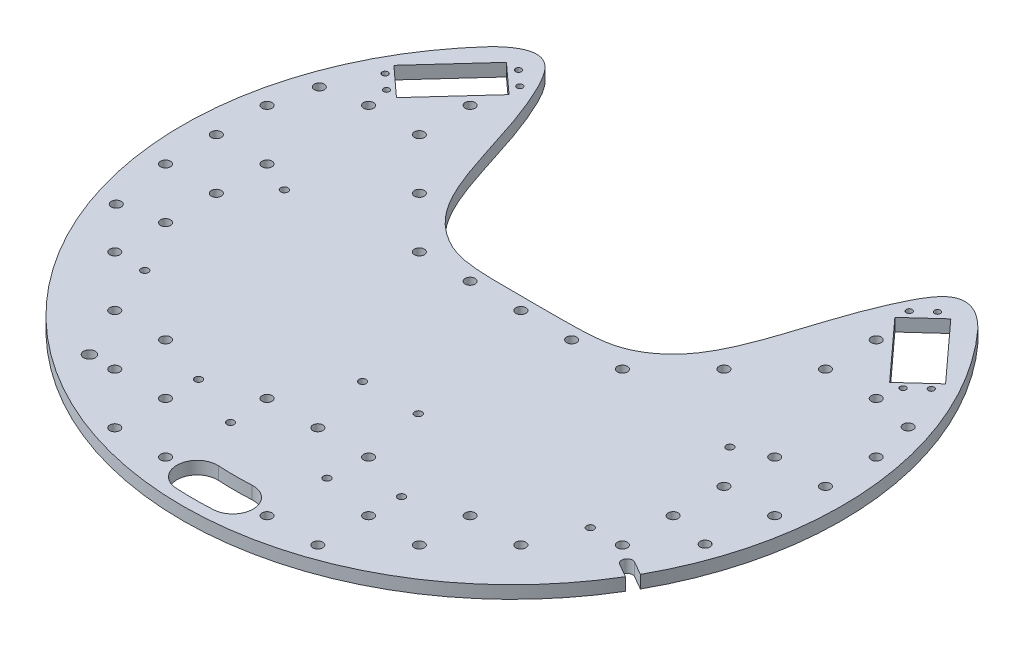
from build123d import *

# Parameters (mm, degrees)
SKETCH1_R                      = 164.975
BOSS_EXTRUDE1_DEPTH            = 6.35
F_6_CLEARANCE_HOLE1_D          = 3.6576
CUT_EXTRUDE1_START             = -6.35
CUT_EXTRUDE1_DEPTH             = 6.35
F_6_CLEARANCE_HOLE2_D          = 3.6576
F_6_CLEARANCE_HOLE2_DEPTH      = 25.4
F_6_CLEARANCE_HOLE2_TIP        = 1.0988539
F_10_CLEARANCE_HOLE3_D         = 4.9784
CUT_EXTRUDE2_DEPTH             = 234.396280641
F_4_CLEARANCE_HOLE1_AT_2_COUNT = 2
F_4_CLEARANCE_HOLE1_AT_2_PITCH = 10
F_4_CLEARANCE_HOLE1_AT_3_COUNT = 2
F_4_CLEARANCE_HOLE1_AT_3_PITCH = 48.306392952
F_4_CLEARANCE_HOLE1_AT_4_COUNT = 2
F_4_CLEARANCE_HOLE1_AT_4_PITCH = 47.26
F_6_CLEARANCE_HOLE5_D          = 3.6576
F_6_CLEARANCE_HOLE5_DEPTH      = 9.906
F_6_CLEARANCE_HOLE5_TIP        = 1.0988539
LPATTERN1_COUNT                = 7
LPATTERN1_PITCH                = 25.4
LPATTERN1_COUNT_DIR2           = 7
LPATTERN1_PITCH_DIR2           = 25.4
LPATTERN3_COUNT                = 4
LPATTERN3_PITCH                = 25.4
LPATTERN3_COUNT_DIR2           = 7
LPATTERN3_PITCH_DIR2           = 25.4
CUT_EXTRUDE3_DEPTH             = 234.396280641
SWITCH_HOLE_D                  = 5.8166
CUT_EXTRUDE4_DEPTH             = 234.396280641


# Read off the part's stored shape, not the designer's step: Cut-Extrude1
with BuildPart() as part:
    # Sketch1 → Boss-Extrude1 (new body)
    with BuildSketch(Plane(origin=(0, 0, 0), x_dir=(1, 0, 0), z_dir=(0, 1, 0))):
        with Locations(Location((0, 0, 0), (0, 0, 270))):
            Circle(SKETCH1_R)
    extrude(amount=BOSS_EXTRUDE1_DEPTH)

    # #6 Clearance Hole1 (through all)
    with Locations(Plane(origin=(111.465, 0, 2.54), x_dir=(0, 0, -1), z_dir=(0, -1, 0))):
        with Locations((0, 0), (-69.85, 0), (-69.85, -222.93), (0, -222.93)):
            Hole(F_6_CLEARANCE_HOLE1_D / 2)

    # Cut-Extrude1 outline → Cut-Extrude1 (cut)
    with BuildSketch(Plane(origin=(0, 6.35, 0), x_dir=(1, 0, 0), z_dir=(0, 1, 0)).offset(CUT_EXTRUDE1_START)):
        with BuildLine():
            add(Edge.make_bspline(
                [(-121.988554403, 111.065490679), (-113.823727633, 119.197396711), (-102.201622841, 123.81559601), (-77.6900656, 78.016737099), (-73.324622305, 34.879062258), (-40.365853898, 10.287477897), (-27.051658004, 10.681054333), (27.051658004, 10.681054333), (40.365853898, 10.287477897), (73.324622305, 34.879062258), (77.6900656, 78.016737099), (102.201622841, 123.81559601), (113.823727633, 119.197396711), (121.988554403, 111.065490679)],
                knots=[0, 0, 0, 0, 0.147126524, 0.222478827, 0.62365317, 0.69844766, 0.920276928, 0.920276928, 1.142106197, 1.216900687, 1.61807503, 1.693427333, 1.840553857, 1.840553857, 1.840553857, 1.840553857], degree=3))
            ThreePointArc((121.988554403, 111.065490679), (0, 164.975), (-121.988554403, 111.065490679))
        make_face()
    extrude(amount=CUT_EXTRUDE1_DEPTH, mode=Mode.SUBTRACT)

    # #6 Clearance Hole2
    with Locations(Plane(origin=(50.8, 6.35, 106.158945667), x_dir=(0, 0, 1), z_dir=(0, 1, 0))):
        with Locations((0, 0), (0, -101.6)):
            Hole(F_6_CLEARANCE_HOLE2_D / 2, depth=F_6_CLEARANCE_HOLE2_DEPTH)
            with Locations((0, 0, -(F_6_CLEARANCE_HOLE2_DEPTH + F_6_CLEARANCE_HOLE2_TIP / 2))):  # 118° drill point
                Cone(0, F_6_CLEARANCE_HOLE2_D / 2, F_6_CLEARANCE_HOLE2_TIP, mode=Mode.SUBTRACT)

    # #10 Clearance Hole3 (through all)
    with Locations(Plane(origin=(0, 6.35, 0), x_dir=(-1, 0, 0), z_dir=(0, 1, 0))):
        with Locations((147.32, -50.8), (147.32, 50.8), (-147.32, -50.8), (-147.32, 50.8)):
            Hole(F_10_CLEARANCE_HOLE3_D / 2)

    # Sketch20 → Cut-Extrude2 (cut, through all)
    with BuildSketch(Plane(origin=(0, 6.35, 0), x_dir=(1, 0, 0), z_dir=(0, 1, 0))):
        Polygon((-109.699539663, 80.469088467), (-96.519999999, 94.930350177), (-111.1630807, 108.275593959), (-124.593870916, 93.538647356), (-138.024661132, 78.801700753), (-130.703120781, 72.129078862), (-123.381580431, 65.456456971), align=None)
    cut_extrude2 = extrude(amount=-CUT_EXTRUDE2_DEPTH, mode=Mode.SUBTRACT)

    # Sketch21 → #4 Clearance Hole1 (revolve, cut)
    with BuildSketch(Plane(origin=(-104.804802432, 6.35, -107.979426396), x_dir=(0, 0, 1), z_dir=(1, 0, 0))):
        Polygon((0, 0), (0, 10.791187864), (1.4732, 9.906), (1.4732, 0), align=None)
    f_4_clearance_hole1 = revolve(axis=Axis((-104.804802432, 12.7, -107.979426396), (0, -1, 0)), mode=Mode.SUBTRACT)

    # #4 Clearance Hole1 at 2: #4 Clearance Hole1 ×2
    with Locations(*[Vector(0.739101589998467, 0, 0.6735939724060319) * (i * F_4_CLEARANCE_HOLE1_AT_2_PITCH) for i in range(1, F_4_CLEARANCE_HOLE1_AT_2_COUNT)]):
        add(f_4_clearance_hole1, mode=Mode.SUBTRACT)

    # #4 Clearance Hole1 at 3: #4 Clearance Hole1 ×2
    with Locations(*[Vector(-0.506000008329856, 0, 0.8625334727244999) * (i * F_4_CLEARANCE_HOLE1_AT_3_PITCH) for i in range(1, F_4_CLEARANCE_HOLE1_AT_3_COUNT)]):
        add(f_4_clearance_hole1, mode=Mode.SUBTRACT)

    # #4 Clearance Hole1 at 4: #4 Clearance Hole1 ×2
    with Locations(*[Vector(-0.6735939724060289, 0, 0.7391015899984696) * (i * F_4_CLEARANCE_HOLE1_AT_4_PITCH) for i in range(1, F_4_CLEARANCE_HOLE1_AT_4_COUNT)]):
        add(f_4_clearance_hole1, mode=Mode.SUBTRACT)

    # Mirror2: Cut-Extrude2, #4 Clearance Hole1 across plane
    add(cut_extrude2.mirror(Plane(origin=(0, 0, 0), x_dir=(0, 0, 1), z_dir=(1, 0, 0))), mode=Mode.SUBTRACT)
    add(f_4_clearance_hole1.mirror(Plane(origin=(0, 0, 0), x_dir=(0, 0, 1), z_dir=(1, 0, 0))), mode=Mode.SUBTRACT)

    # Mirror2 copy 1 sketch → Mirror2 copy 1 (revolve, cut)
    with BuildSketch(Plane(origin=(97.413786532, 6.35, -101.243486672), x_dir=(0, 0, 1), z_dir=(-1, 0, 0))):
        Polygon((0, 0), (0, -10.791187864), (1.4732, -9.906), (1.4732, 0), align=None)
    revolve(axis=Axis((97.413786532, 12.7, -101.243486672), (0, 1, 0)), mode=Mode.SUBTRACT)

    # Mirror2 copy 2 sketch → Mirror2 copy 2 (revolve, cut)
    with BuildSketch(Plane(origin=(129.247837668, 6.35, -66.313545529), x_dir=(0, 0, 1), z_dir=(-1, 0, 0))):
        Polygon((0, 0), (0, -10.791187864), (1.4732, -9.906), (1.4732, 0), align=None)
    revolve(axis=Axis((129.247837668, 12.7, -66.313545529), (0, 1, 0)), mode=Mode.SUBTRACT)

    # Mirror2 copy 3 sketch → Mirror2 copy 3 (revolve, cut)
    with BuildSketch(Plane(origin=(136.638853568, 6.35, -73.049485253), x_dir=(0, 0, 1), z_dir=(-1, 0, 0))):
        Polygon((0, 0), (0, -10.791187864), (1.4732, -9.906), (1.4732, 0), align=None)
    revolve(axis=Axis((136.638853568, 12.7, -73.049485253), (0, 1, 0)), mode=Mode.SUBTRACT)

    # #6 Clearance Hole5
    with Locations(Plane(origin=(-24.129999999, 6.35, 116.84), x_dir=(0, 0, 1), z_dir=(0, 1, 0))):
        with Locations((0, 0), (0, 48.26), (-50.8, 43.18), (-50.8, 15.24)):
            Hole(F_6_CLEARANCE_HOLE5_D / 2, depth=F_6_CLEARANCE_HOLE5_DEPTH)
            with Locations((0, 0, -(F_6_CLEARANCE_HOLE5_DEPTH + F_6_CLEARANCE_HOLE5_TIP / 2))):  # 118° drill point
                Cone(0, F_6_CLEARANCE_HOLE5_D / 2, F_6_CLEARANCE_HOLE5_TIP, mode=Mode.SUBTRACT)

    # Sketch25 → #10 Clearance Hole5 (revolve, cut)
    with BuildSketch(Plane(origin=(0, 6.35, -4.331054333), x_dir=(0, 0, 1), z_dir=(1, 0, 0))):
        Polygon((0, 0), (0, 11.401662253), (2.4892, 9.906), (2.4892, 0), align=None)
    f_10_clearance_hole5 = revolve(axis=Axis((0, 12.7, -4.331054333), (0, -1, 0)), mode=Mode.SUBTRACT)

    # LPattern1: 10 Clearance Hole5 7 × 7, 34 skipped
    with Locations(*[(j * LPATTERN1_PITCH_DIR2, 0, i * LPATTERN1_PITCH) for i in range(LPATTERN1_COUNT) for j in range(LPATTERN1_COUNT_DIR2) if (i, j) not in ((0, 0), (0, 1), (0, 2), (0, 3), (0, 4), (1, 0), (1, 1), (1, 2), (1, 3), (1, 4), (2, 0), (2, 1), (2, 2), (2, 3), (2, 4), (2, 6), (3, 0), (3, 1), (3, 2), (3, 3), (3, 4), (3, 6), (4, 2), (4, 5), (4, 6), (5, 0), (5, 1), (5, 4), (5, 5), (5, 6), (6, 0), (6, 3), (6, 4), (6, 5), (6, 6))]):
        add(f_10_clearance_hole5, mode=Mode.SUBTRACT)

    # LPattern3: 10 Clearance Hole5 4 × 7, 18 skipped
    with Locations(*[(j * LPATTERN3_PITCH_DIR2, 0, -i * LPATTERN3_PITCH) for i in range(LPATTERN3_COUNT) for j in range(LPATTERN3_COUNT_DIR2) if (i, j) not in ((0, 0), (0, 3), (0, 4), (1, 0), (1, 1), (1, 2), (1, 4), (1, 5), (2, 0), (2, 1), (2, 2), (2, 3), (2, 6), (3, 0), (3, 1), (3, 2), (3, 3), (3, 5), (3, 6))]):
        add(f_10_clearance_hole5, mode=Mode.SUBTRACT)

    # Mirror3 copy 1 sketch → Mirror3 copy 1 (revolve, cut)
    with BuildSketch(Plane(origin=(-127, 6.35, -4.331054333), x_dir=(0, 0, 1), z_dir=(-1, 0, 0))):
        Polygon((0, 0), (0, -11.401662253), (2.4892, -9.906), (2.4892, 0), align=None)
    revolve(axis=Axis((-127, 12.7, -4.331054333), (0, 1, 0)), mode=Mode.SUBTRACT)

    # Mirror3 copy 2 sketch → Mirror3 copy 2 (revolve, cut)
    with BuildSketch(Plane(origin=(-152.4, 6.35, -4.331054333), x_dir=(0, 0, 1), z_dir=(-1, 0, 0))):
        Polygon((0, 0), (0, -11.401662253), (2.4892, -9.906), (2.4892, 0), align=None)
    revolve(axis=Axis((-152.4, 12.7, -4.331054333), (0, 1, 0)), mode=Mode.SUBTRACT)

    # Mirror3 copy 3 sketch → Mirror3 copy 3 (revolve, cut)
    with BuildSketch(Plane(origin=(-127, 6.35, 21.068945667), x_dir=(0, 0, 1), z_dir=(-1, 0, 0))):
        Polygon((0, 0), (0, -11.401662253), (2.4892, -9.906), (2.4892, 0), align=None)
    revolve(axis=Axis((-127, 12.7, 21.068945667), (0, 1, 0)), mode=Mode.SUBTRACT)

    # Mirror3 copy 4 sketch → Mirror3 copy 4 (revolve, cut)
    with BuildSketch(Plane(origin=(-152.4, 6.35, 21.068945667), x_dir=(0, 0, 1), z_dir=(-1, 0, 0))):
        Polygon((0, 0), (0, -11.401662253), (2.4892, -9.906), (2.4892, 0), align=None)
    revolve(axis=Axis((-152.4, 12.7, 21.068945667), (0, 1, 0)), mode=Mode.SUBTRACT)

    # Mirror3 copy 5 sketch → Mirror3 copy 5 (revolve, cut)
    with BuildSketch(Plane(origin=(-127, 6.35, 46.468945667), x_dir=(0, 0, 1), z_dir=(-1, 0, 0))):
        Polygon((0, 0), (0, -11.401662253), (2.4892, -9.906), (2.4892, 0), align=None)
    revolve(axis=Axis((-127, 12.7, 46.468945667), (0, 1, 0)), mode=Mode.SUBTRACT)

    # Mirror3 copy 6 sketch → Mirror3 copy 6 (revolve, cut)
    with BuildSketch(Plane(origin=(-127, 6.35, 71.868945667), x_dir=(0, 0, 1), z_dir=(-1, 0, 0))):
        Polygon((0, 0), (0, -11.401662253), (2.4892, -9.906), (2.4892, 0), align=None)
    revolve(axis=Axis((-127, 12.7, 71.868945667), (0, 1, 0)), mode=Mode.SUBTRACT)

    # Mirror3 copy 7 sketch → Mirror3 copy 7 (revolve, cut)
    with BuildSketch(Plane(origin=(0, 6.35, 97.268945667), x_dir=(0, 0, 1), z_dir=(-1, 0, 0))):
        Polygon((0, 0), (0, -11.401662253), (2.4892, -9.906), (2.4892, 0), align=None)
    revolve(axis=Axis((0, 12.7, 97.268945667), (0, 1, 0)), mode=Mode.SUBTRACT)

    # Mirror3 copy 8 sketch → Mirror3 copy 8 (revolve, cut)
    with BuildSketch(Plane(origin=(-25.4, 6.35, 97.268945667), x_dir=(0, 0, 1), z_dir=(-1, 0, 0))):
        Polygon((0, 0), (0, -11.401662253), (2.4892, -9.906), (2.4892, 0), align=None)
    revolve(axis=Axis((-25.4, 12.7, 97.268945667), (0, 1, 0)), mode=Mode.SUBTRACT)

    # Mirror3 copy 9 sketch → Mirror3 copy 9 (revolve, cut)
    with BuildSketch(Plane(origin=(-76.2, 6.35, 97.268945667), x_dir=(0, 0, 1), z_dir=(-1, 0, 0))):
        Polygon((0, 0), (0, -11.401662253), (2.4892, -9.906), (2.4892, 0), align=None)
    revolve(axis=Axis((-76.2, 12.7, 97.268945667), (0, 1, 0)), mode=Mode.SUBTRACT)

    # Mirror3 copy 10 sketch → Mirror3 copy 10 (revolve, cut)
    with BuildSketch(Plane(origin=(-101.6, 6.35, 97.268945667), x_dir=(0, 0, 1), z_dir=(-1, 0, 0))):
        Polygon((0, 0), (0, -11.401662253), (2.4892, -9.906), (2.4892, 0), align=None)
    revolve(axis=Axis((-101.6, 12.7, 97.268945667), (0, 1, 0)), mode=Mode.SUBTRACT)

    # Mirror3 copy 11 sketch → Mirror3 copy 11 (revolve, cut)
    with BuildSketch(Plane(origin=(-50.8, 6.35, 122.668945667), x_dir=(0, 0, 1), z_dir=(-1, 0, 0))):
        Polygon((0, 0), (0, -11.401662253), (2.4892, -9.906), (2.4892, 0), align=None)
    revolve(axis=Axis((-50.8, 12.7, 122.668945667), (0, 1, 0)), mode=Mode.SUBTRACT)

    # Mirror3 copy 12 sketch → Mirror3 copy 12 (revolve, cut)
    with BuildSketch(Plane(origin=(-76.2, 6.35, 122.668945667), x_dir=(0, 0, 1), z_dir=(-1, 0, 0))):
        Polygon((0, 0), (0, -11.401662253), (2.4892, -9.906), (2.4892, 0), align=None)
    revolve(axis=Axis((-76.2, 12.7, 122.668945667), (0, 1, 0)), mode=Mode.SUBTRACT)

    # Mirror3 copy 13 sketch → Mirror3 copy 13 (revolve, cut)
    with BuildSketch(Plane(origin=(-25.4, 6.35, 148.068945667), x_dir=(0, 0, 1), z_dir=(-1, 0, 0))):
        Polygon((0, 0), (0, -11.401662253), (2.4892, -9.906), (2.4892, 0), align=None)
    revolve(axis=Axis((-25.4, 12.7, 148.068945667), (0, 1, 0)), mode=Mode.SUBTRACT)

    # Mirror3 copy 14 sketch → Mirror3 copy 14 (revolve, cut)
    with BuildSketch(Plane(origin=(-50.8, 6.35, 148.068945667), x_dir=(0, 0, 1), z_dir=(-1, 0, 0))):
        Polygon((0, 0), (0, -11.401662253), (2.4892, -9.906), (2.4892, 0), align=None)
    revolve(axis=Axis((-50.8, 12.7, 148.068945667), (0, 1, 0)), mode=Mode.SUBTRACT)

    # Mirror3 copy 15 sketch → Mirror3 copy 15 (revolve, cut)
    with BuildSketch(Plane(origin=(0, 6.35, -4.331054333), x_dir=(0, 0, 1), z_dir=(-1, 0, 0))):
        Polygon((0, 0), (0, -11.401662253), (2.4892, -9.906), (2.4892, 0), align=None)
    revolve(axis=Axis((0, 12.7, -4.331054333), (0, 1, 0)), mode=Mode.SUBTRACT)

    # Mirror3 copy 16 sketch → Mirror3 copy 16 (revolve, cut)
    with BuildSketch(Plane(origin=(-25.4, 6.35, -4.331054333), x_dir=(0, 0, 1), z_dir=(-1, 0, 0))):
        Polygon((0, 0), (0, -11.401662253), (2.4892, -9.906), (2.4892, 0), align=None)
    revolve(axis=Axis((-25.4, 12.7, -4.331054333), (0, 1, 0)), mode=Mode.SUBTRACT)

    # Mirror3 copy 17 sketch → Mirror3 copy 17 (revolve, cut)
    with BuildSketch(Plane(origin=(-50.8, 6.35, -4.331054333), x_dir=(0, 0, 1), z_dir=(-1, 0, 0))):
        Polygon((0, 0), (0, -11.401662253), (2.4892, -9.906), (2.4892, 0), align=None)
    revolve(axis=Axis((-50.8, 12.7, -4.331054333), (0, 1, 0)), mode=Mode.SUBTRACT)

    # Mirror3 copy 18 sketch → Mirror3 copy 18 (revolve, cut)
    with BuildSketch(Plane(origin=(-127, 6.35, -4.331054333), x_dir=(0, 0, 1), z_dir=(-1, 0, 0))):
        Polygon((0, 0), (0, -11.401662253), (2.4892, -9.906), (2.4892, 0), align=None)
    revolve(axis=Axis((-127, 12.7, -4.331054333), (0, 1, 0)), mode=Mode.SUBTRACT)

    # Mirror3 copy 19 sketch → Mirror3 copy 19 (revolve, cut)
    with BuildSketch(Plane(origin=(-152.4, 6.35, -4.331054333), x_dir=(0, 0, 1), z_dir=(-1, 0, 0))):
        Polygon((0, 0), (0, -11.401662253), (2.4892, -9.906), (2.4892, 0), align=None)
    revolve(axis=Axis((-152.4, 12.7, -4.331054333), (0, 1, 0)), mode=Mode.SUBTRACT)

    # Mirror3 copy 20 sketch → Mirror3 copy 20 (revolve, cut)
    with BuildSketch(Plane(origin=(-76.2, 6.35, -29.731054333), x_dir=(0, 0, 1), z_dir=(-1, 0, 0))):
        Polygon((0, 0), (0, -11.401662253), (2.4892, -9.906), (2.4892, 0), align=None)
    revolve(axis=Axis((-76.2, 12.7, -29.731054333), (0, 1, 0)), mode=Mode.SUBTRACT)

    # Mirror3 copy 21 sketch → Mirror3 copy 21 (revolve, cut)
    with BuildSketch(Plane(origin=(-152.4, 6.35, -29.731054333), x_dir=(0, 0, 1), z_dir=(-1, 0, 0))):
        Polygon((0, 0), (0, -11.401662253), (2.4892, -9.906), (2.4892, 0), align=None)
    revolve(axis=Axis((-152.4, 12.7, -29.731054333), (0, 1, 0)), mode=Mode.SUBTRACT)

    # Mirror3 copy 22 sketch → Mirror3 copy 22 (revolve, cut)
    with BuildSketch(Plane(origin=(-101.6, 6.35, -55.131054333), x_dir=(0, 0, 1), z_dir=(-1, 0, 0))):
        Polygon((0, 0), (0, -11.401662253), (2.4892, -9.906), (2.4892, 0), align=None)
    revolve(axis=Axis((-101.6, 12.7, -55.131054333), (0, 1, 0)), mode=Mode.SUBTRACT)

    # Mirror3 copy 23 sketch → Mirror3 copy 23 (revolve, cut)
    with BuildSketch(Plane(origin=(-127, 6.35, -55.131054333), x_dir=(0, 0, 1), z_dir=(-1, 0, 0))):
        Polygon((0, 0), (0, -11.401662253), (2.4892, -9.906), (2.4892, 0), align=None)
    revolve(axis=Axis((-127, 12.7, -55.131054333), (0, 1, 0)), mode=Mode.SUBTRACT)

    # Mirror3 copy 24 sketch → Mirror3 copy 24 (revolve, cut)
    with BuildSketch(Plane(origin=(-101.6, 6.35, -80.531054333), x_dir=(0, 0, 1), z_dir=(-1, 0, 0))):
        Polygon((0, 0), (0, -11.401662253), (2.4892, -9.906), (2.4892, 0), align=None)
    revolve(axis=Axis((-101.6, 12.7, -80.531054333), (0, 1, 0)), mode=Mode.SUBTRACT)

    # Mirror3 copy 25 sketch → Mirror3 copy 25 (revolve, cut)
    with BuildSketch(Plane(origin=(0, 6.35, -4.331054333), x_dir=(0, 0, 1), z_dir=(-1, 0, 0))):
        Polygon((0, 0), (0, -11.401662253), (2.4892, -9.906), (2.4892, 0), align=None)
    revolve(axis=Axis((0, 12.7, -4.331054333), (0, 1, 0)), mode=Mode.SUBTRACT)

    # Sketch26 → Cut-Extrude3 (cut, through all)
    with BuildSketch(Plane(origin=(0, 6.35, 0), x_dir=(1, 0, 0), z_dir=(0, 1, 0))):
        with BuildLine():
            ThreePointArc((-9.496244004, -158.863303732), (0, -159.146875316), (9.496244004, -158.863303732))
            ThreePointArc((9.496244004, -158.863303732), (19.031896676, -148.11516305), (8.283755994, -138.579510378))
            ThreePointArc((8.283755994, -138.579510378), (0, -138.826875316), (-8.283755994, -138.579510378))
            ThreePointArc((-8.283755994, -138.579510378), (-19.031896676, -148.11516305), (-9.496244004, -158.863303732))
        make_face()
    extrude(amount=-CUT_EXTRUDE3_DEPTH, mode=Mode.SUBTRACT)

    # switch hole (through all)
    with Locations(Plane(origin=(0, 6.35, 0), x_dir=(-1, 0, 0), z_dir=(0, 1, 0))):
        with Locations((88.9, 122.668945667)):
            Hole(SWITCH_HOLE_D / 2)

    # Sketch30 → Cut-Extrude4 (cut, through all)
    with BuildSketch(Plane(origin=(0, 6.35, 0), x_dir=(1, 0, 0), z_dir=(0, 1, 0))):
        with BuildLine():
            Line((141.509820495, -84.847963786), (134.711914467, -80.923461114))
            ThreePointArc((134.711914467, -80.923461114), (133.712370908, -77.193558545), (137.442273477, -76.194014986))
            Line((137.442273477, -76.194014986), (144.240179505, -80.118517658))
            ThreePointArc((144.240179505, -80.118517658), (145.239723064, -83.848420227), (141.509820495, -84.847963786))
        make_face()
    extrude(amount=-CUT_EXTRUDE4_DEPTH, mode=Mode.SUBTRACT)


solid = part.part
